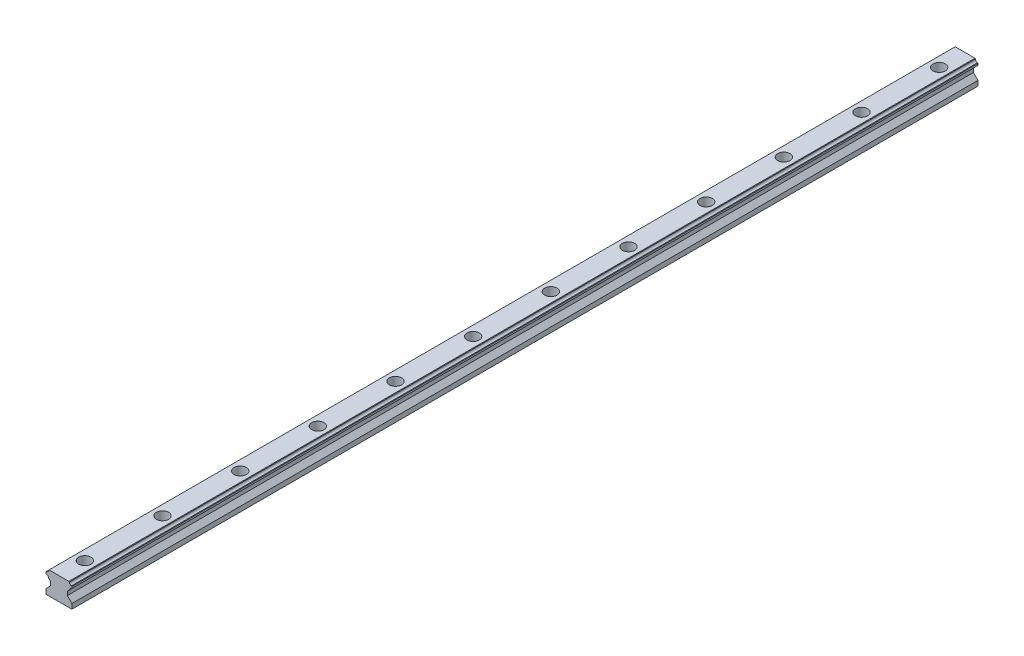
from build123d import *

# Parameters (mm, degrees)
BOSS_EXTRUDE1_DEPTH = 350
SKETCH2_R           = 3
CUT_EXTRUDE1_DEPTH  = 351.579876776
SKETCH3_R           = 4.75
CUT_EXTRUDE2_DEPTH  = 8.5
LPATTERN1_COUNT     = 100
LPATTERN1_PITCH     = 60


with BuildPart() as part:
    # Sketch1 → Boss-Extrude1 (new body)
    with BuildSketch(Plane.XY):
        with BuildLine():
            Line((-6.5, -4.15), (-6.5, -7.15))
            Line((-6.5, -7.15), (-10, -10.65))
            Line((-10, -10.65), (-10, -14.5))
            Line((-10, -14.5), (0, -14.5))
            Line((0, -14.5), (0, 3))
            Line((0, 3), (-7.65, 3))
            Line((-7.65, 3), (-8.003553391, 2.646446609))
            ThreePointArc((-8.003553391, 2.646446609), (-8.484745674, 1.484745674), (-9.646446609, 1.003553391))
            Line((-9.646446609, 1.003553391), (-10, 0.65))
            Line((-10, 0.65), (-10, -0.65))
            Line((-10, -0.65), (-9.646446609, -1.003553391))
            ThreePointArc((-9.646446609, -1.003553391), (-8.484745674, -1.484745674), (-8.003553391, -2.646446609))
            Line((-8.003553391, -2.646446609), (-6.5, -4.15))
        make_face()
    boss_extrude1 = extrude(amount=BOSS_EXTRUDE1_DEPTH)

    # Mirror1: Boss-Extrude1 across plane
    add(boss_extrude1.mirror(Plane(origin=(0, 3, 350), x_dir=(0, 0, 1), z_dir=(-1, 0, 0))))

    # Sketch2 → Cut-Extrude1 (cut, through all)
    with BuildSketch(Plane(origin=(0, 3, 0), x_dir=(1, 0, 0), z_dir=(0, 1, 0))):
        with Locations((0, -30)):
            Circle(SKETCH2_R)
    cut_extrude1 = extrude(amount=-CUT_EXTRUDE1_DEPTH, mode=Mode.SUBTRACT)

    # Sketch3 → Cut-Extrude2 (cut)
    with BuildSketch(Plane(origin=(0, 3, 0), x_dir=(1, 0, 0), z_dir=(0, 1, 0))):
        with Locations((0, -30)):
            Circle(SKETCH3_R)
    cut_extrude2 = extrude(amount=-CUT_EXTRUDE2_DEPTH, mode=Mode.SUBTRACT)

    # LPattern1: Cut-Extrude1, Cut-Extrude2 ×100
    with Locations(*[(0, 0, i * LPATTERN1_PITCH) for i in range(1, LPATTERN1_COUNT)]):
        add(cut_extrude1, mode=Mode.SUBTRACT)
        add(cut_extrude2, mode=Mode.SUBTRACT)

    # Mirror2: part across plane


with BuildPart() as part_1:
    add(part.part)
    add(part.part.mirror(Plane(origin=(-9.646446609, -2.646446609, 0), x_dir=(1, 0, 0), z_dir=(0, 0, -1))))


solid = part_1.part
